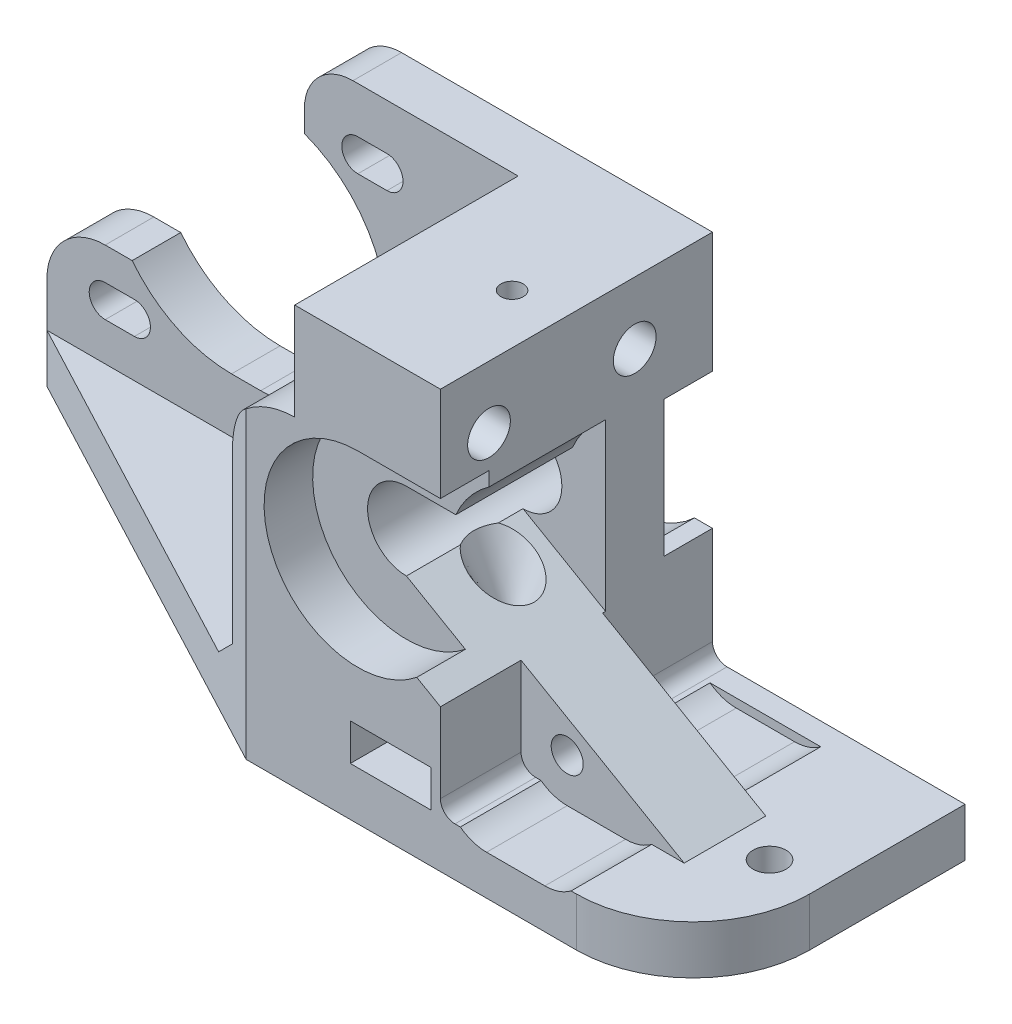
from build123d import *

# Parameters (mm, degrees)
SKETCH1_R                = 4
BOSS_EXTRUDE1_DEPTH      = 28
SKETCH2_W                = 40.5
SKETCH2_H                = 38
CUT_EXTRUDE1_DEPTH       = 23
SKETCH3_R                = 9.65
CUT_EXTRUDE2_DEPTH       = 5
SKETCH8_R                = 1.15
CUT_EXTRUDE7_DEPTH       = 76.219678276
SKETCH9_R                = 2.2
CUT_EXTRUDE8_DEPTH       = 97.701654612
CUT_EXTRUDE9_DEPTH       = 3
CUT_EXTRUDE9_DEPTH_BACK  = 11
CHAMFER2_SIZE            = 3
SKETCH16_W               = 26
SKETCH16_H               = 38
CUT_EXTRUDE12_DEPTH      = 67.075411541
CUT_EXTRUDE3_START       = -5
CUT_EXTRUDE3_DEPTH       = 5
FILLET6_R                = 1.5
CUT_EXTRUDE13_START      = -5
CUT_EXTRUDE13_DEPTH      = 5
BOSS_EXTRUDE3_DEPTH      = 4.2
BOSS_EXTRUDE3_DEPTH_BACK = 4.2
SKETCH21_R               = 1.65
SKETCH15_R               = 1.7
CUT_EXTRUDE11_DEPTH      = 76.219678334
CUT_EXTRUDE14_DEPTH      = 9
FILLET1_R                = 5
FILLET2_R                = 6
FILLET4_R                = 12
CUT_EXTRUDE15_DEPTH      = 3.8
CUT_EXTRUDE18_REACH      = 77.22
SKETCH26_R               = 3.15
CUT_EXTRUDE19_START      = -12
CUT_EXTRUDE19_DEPTH      = 12
CUT_EXTRUDE20_DEPTH      = 62.824024457
CUT_EXTRUDE20_DEPTH_BACK = 4.5
SKETCH28_R               = 10
SKETCH29_W               = 23
SKETCH29_H               = 10
CUT_EXTRUDE21_DEPTH      = 8
FILLET7_R                = 8
CHAMFER1_SIZE            = 23
CHAMFER1_SIZE2           = 43.5


with BuildPart() as part:
    # Sketch1 → Boss-Extrude1 (new body)
    with BuildSketch(Plane.XY):
        with BuildLine():
            Line((-55, -23.6), (34.5, -23.6))
            Line((34.5, -23.6), (34.5, 19.4))
            Line((34.5, 19.4), (-28.5, 19.4))
            Line((-28.5, 19.4), (-28.5, 12.180409823))
            ThreePointArc((-28.5, 12.180409823), (-20.217668105, -2.285689125), (-33, -12.985083113))
            Line((-33, -12.985083113), (-36, -12.985083113))
            ThreePointArc((-36, -12.985083113), (-41.689100041, -11.672468641), (-46.228019527, -8))
            Line((-46.228019527, -8), (-55, -8))
            Line((-55, -8), (-55, -23.6))
        make_face()
        Circle(SKETCH1_R, mode=Mode.SUBTRACT)
        with BuildLine():
            Line((-23, 11.35), (-20, 11.35))
            ThreePointArc((-20, 11.35), (-18.35, 13), (-20, 14.65))
            Line((-20, 14.65), (-23, 14.65))
            ThreePointArc((-23, 14.65), (-24.65, 13), (-23, 11.35))
        make_face(mode=Mode.SUBTRACT)
        with BuildLine():
            Line((-23, -14.65), (-20, -14.65))
            ThreePointArc((-20, -14.65), (-18.35, -13), (-20, -11.35))
            Line((-20, -11.35), (-23, -11.35))
            ThreePointArc((-23, -11.35), (-24.65, -13), (-23, -14.65))
        make_face(mode=Mode.SUBTRACT)
        with BuildLine():
            Line((-46, -11.35), (-49, -11.35))
            ThreePointArc((-49, -11.35), (-50.65, -13), (-49, -14.65))
            Line((-49, -14.65), (-46, -14.65))
            ThreePointArc((-46, -14.65), (-44.35, -13), (-46, -11.35))
        make_face(mode=Mode.SUBTRACT)
    extrude(amount=BOSS_EXTRUDE1_DEPTH)

    # Sketch2 → Cut-Extrude1 (cut)
    with BuildSketch(Plane.XY.offset(28)):
        with Locations((-34.75, 0.4)):
            Rectangle(SKETCH2_W, SKETCH2_H)
    extrude(amount=-CUT_EXTRUDE1_DEPTH, mode=Mode.SUBTRACT)

    # Sketch3 → Cut-Extrude2 (cut)
    with BuildSketch(Plane.XY.offset(28)):
        Circle(SKETCH3_R)
    extrude(amount=-CUT_EXTRUDE2_DEPTH, mode=Mode.SUBTRACT)

    # Sketch8 → Cut-Extrude7 (cut, through all)
    with BuildSketch(Plane.XZ.offset(23.6)):
        with Locations(Location((3.375, 15.5, 0), (0, 0, 270))):
            Circle(SKETCH8_R)
    extrude(amount=-CUT_EXTRUDE7_DEPTH, mode=Mode.SUBTRACT)

    # Sketch9 → Cut-Extrude8 (cut, through all)
    with BuildSketch(Plane(origin=(34.5, 0, 0), x_dir=(0, 0, -1), z_dir=(1, 0, 0))):
        with Locations((-8, 13)):
            Circle(SKETCH9_R)
        with Locations((-23, 13)):
            Circle(SKETCH9_R)
    extrude(amount=-CUT_EXTRUDE8_DEPTH, mode=Mode.SUBTRACT)

    # Sketch10 → Cut-Extrude9 (cut, two sides: drawn at the far end of the back side and taken through both)
    with BuildSketch(Plane.ZY.offset(14.5).offset(-CUT_EXTRUDE9_DEPTH_BACK)):
        Polygon((5.1, 14.674315781), (5.1, 11.325684219), (8, 9.651368439), (10.9, 11.325684219), (10.9, 14.674315781), (8, 16.348631561), align=None)
        Polygon((25.9, 11.325684219), (25.9, 14.674315781), (23, 16.348631561), (20.1, 14.674315781), (20.1, 11.325684219), (23, 9.651368439), align=None)
    extrude(amount=CUT_EXTRUDE9_DEPTH + CUT_EXTRUDE9_DEPTH_BACK, mode=Mode.SUBTRACT)

    # Chamfer2
    chamfer2_edges = [part.edges().sort_by_distance(p)[0] for p in [
        (-14.5, -18.6, 16.5),
    ]]
    chamfer(chamfer2_edges, length=CHAMFER2_SIZE)

    # Sketch16 → Cut-Extrude12 (cut, through all)
    with BuildSketch(Plane.XY.offset(28)):
        with Locations((21.5, 0.4)):
            Rectangle(SKETCH16_W, SKETCH16_H)
    extrude(amount=-CUT_EXTRUDE12_DEPTH, mode=Mode.SUBTRACT)

    # Sketch4 → Cut-Extrude3 (cut)
    with BuildSketch(Plane(origin=(0, 0, 0), x_dir=(-1, 0, 0), z_dir=(0, 0, -1)).offset(CUT_EXTRUDE3_START)):
        with BuildLine():
            Line((-36.31147183, -7), (-6.642476948, -7))
            ThreePointArc((-6.642476948, -7), (9.65, 0), (-6.642476948, 7))
            Line((-6.642476948, 7), (-36.31147183, 7))
            Line((-36.31147183, 7), (-36.31147183, -7))
        make_face()
    extrude(amount=CUT_EXTRUDE3_DEPTH, mode=Mode.SUBTRACT)

    # Fillet6
    fillet6_edges = [part.edges().sort_by_distance(p)[0] for p in [
        (8.5, -18.6, 14),
    ]]
    fillet(fillet6_edges, radius=FILLET6_R)

    # Sketch17 → Cut-Extrude13 (cut)
    with BuildSketch(Plane.XY.offset(28).offset(CUT_EXTRUDE13_START)):
        with BuildLine():
            Line((0, 4), (0, 9.65))
            Line((0, 9.65), (8.5, 9.65))
            Line((8.5, 9.65), (8.5, -8.907477288))
            Line((8.5, -8.907477288), (0, -4))
            ThreePointArc((0, -4), (4, 0), (0, 4))
        make_face()
    extrude(amount=CUT_EXTRUDE13_DEPTH, mode=Mode.SUBTRACT)

    # Sketch20 → Cut-Revolve1 (revolve, cut)
    with BuildSketch(Plane.XY.offset(15.5), mode=Mode.PRIVATE) as cut_revolve1_sk:
        Polygon((3.375, -11.8), (7.375, -3.8), (3.375, -3.8), align=None)
    revolve(cut_revolve1_sk.sketch.rotate(Axis((3.375, -3.8, 15.5), (0, -1, 0)), 270), axis=Axis((3.375, -3.8, 15.5), (0, -1, 0)), mode=Mode.SUBTRACT)

    # Sketch21 → Boss-Extrude3 (add, two sides: drawn at the far end of the back side and taken through both)
    with BuildSketch(Plane.XY.offset(15.5).offset(-BOSS_EXTRUDE3_DEPTH_BACK)):
        Polygon((7.25, -8.185789452), (7.25, -18.6), (25.287941791, -18.6), align=None)
        with Locations((13.25, -15)):
            Circle(SKETCH21_R, mode=Mode.SUBTRACT)
    extrude(amount=BOSS_EXTRUDE3_DEPTH + BOSS_EXTRUDE3_DEPTH_BACK)

    # Sketch15 → Cut-Extrude11 (cut, through all)
    with BuildSketch(Plane.XZ.offset(23.6)):
        with Locations(Location((-20.625, 15, 0), (0, 0, 270))):
            Circle(SKETCH15_R)
        with Locations(Location((29.375, 15, 0), (0, 0, 270))):
            Circle(SKETCH15_R)
    extrude(amount=-CUT_EXTRUDE11_DEPTH, mode=Mode.SUBTRACT)

    # Sketch22 → Cut-Extrude14 (cut)
    with BuildSketch(Plane.XY.offset(19.7)):
        with BuildLine():
            Line((13.25, -19.5), (19.25, -19.5))
            ThreePointArc((19.25, -19.5), (23.75, -15), (19.25, -10.5))
            Line((19.25, -10.5), (13.25, -10.5))
            ThreePointArc((13.25, -10.5), (8.75, -15), (13.25, -19.5))
        make_face()
    cut_extrude14 = extrude(amount=CUT_EXTRUDE14_DEPTH, mode=Mode.SUBTRACT)

    # Mirror1: Cut-Extrude14 across plane
    add(cut_extrude14.mirror(Plane.XY.offset(15.5)), mode=Mode.SUBTRACT)

    # Fillet1
    fillet1_edges = [part.edges().sort_by_distance(p)[0] for p in [
        (-28.5, 19.4, 2.5),
    ]]
    fillet(fillet1_edges, radius=FILLET1_R)

    # Fillet2
    fillet2_edges = [part.edges().sort_by_distance(p)[0] for p in [
        (-55, -8, 2.5),
    ]]
    fillet(fillet2_edges, radius=FILLET2_R)

    # Fillet4
    fillet4_edges = [part.edges().sort_by_distance(p)[0] for p in [
        (34.5, -21.1, 28),
    ]]
    fillet(fillet4_edges, radius=FILLET4_R)

    # Sketch23 → Cut-Extrude15 (cut)
    with BuildSketch(Plane.XZ.offset(18.6)):
        Polygon((-0.775, 28.722034997), (7.525, 28.722034997), (7.525, 13.103996383), (3.375, 10.707992766), (-0.775, 13.103996383), align=None)
    extrude(amount=-CUT_EXTRUDE15_DEPTH, mode=Mode.SUBTRACT)

    # Sketch26 → Cut-Extrude18 (cut, up to next)
    with BuildSketch(Plane.XZ.offset(23.6), mode=Mode.PRIVATE) as cut_extrude18_sk1:
        with Locations(Location((3.375, 15.5, 0), (0, 0, 270))):
            Circle(SKETCH26_R)
    cut_extrude18_tool1 = extrude(cut_extrude18_sk1.sketch, amount=-CUT_EXTRUDE18_REACH, mode=Mode.PRIVATE) & part.part
    add(cut_extrude18_tool1.solids().sort_by_distance((3.375, -23.6, 15.5))[0], mode=Mode.SUBTRACT)

    # Sketch27 → Cut-Extrude19 (cut)
    with BuildSketch(Plane.XY.offset(23).offset(CUT_EXTRUDE19_START)):
        with BuildLine():
            Line((8.5, -8.907477288), (0, -4))
            ThreePointArc((0, -4), (-4, 0), (0, 4))
            Line((0, 4), (8.5, 4))
            Line((8.5, 4), (8.5, -8.907477288))
        make_face()
    extrude(amount=CUT_EXTRUDE19_DEPTH, mode=Mode.SUBTRACT)

    # Sketch28 → Cut-Extrude20 (cut, two sides: drawn at the far end of the back side and taken through both)
    with BuildSketch(Plane.XY.offset(15.5).offset(-CUT_EXTRUDE20_DEPTH_BACK)):
        with Locations((14.25, 0)):
            Circle(SKETCH28_R)
    extrude(amount=CUT_EXTRUDE20_DEPTH + CUT_EXTRUDE20_DEPTH_BACK, mode=Mode.SUBTRACT)

    # Sketch29 → Cut-Extrude21 (cut)
    with BuildSketch(Plane.ZY.offset(14.5)):
        with Locations((16.5, 14.4)):
            Rectangle(SKETCH29_W, SKETCH29_H)
    extrude(amount=-CUT_EXTRUDE21_DEPTH, mode=Mode.SUBTRACT)

    # Fillet7
    fillet7_edges = [part.edges().sort_by_distance(p)[0] for p in [
        (-14.5, 9.4, 16.5),
    ]]
    fillet(fillet7_edges, radius=FILLET7_R - 0.0001)  # a hair under: the kernel refuses the full size

    # Chamfer1
    chamfer1_edges = [part.edges().sort_by_distance(p)[0] for p in [
        (-55, -21.1, 28),
    ]]
    chamfer1_side = [part.faces().sort_by_distance(p)[0] for p in [
        (-55, -20.422699387, 12.377300613),
    ]]
    chamfer(chamfer1_edges, length=CHAMFER1_SIZE, length2=CHAMFER1_SIZE2, reference=chamfer1_side[0])


solid = part.part
